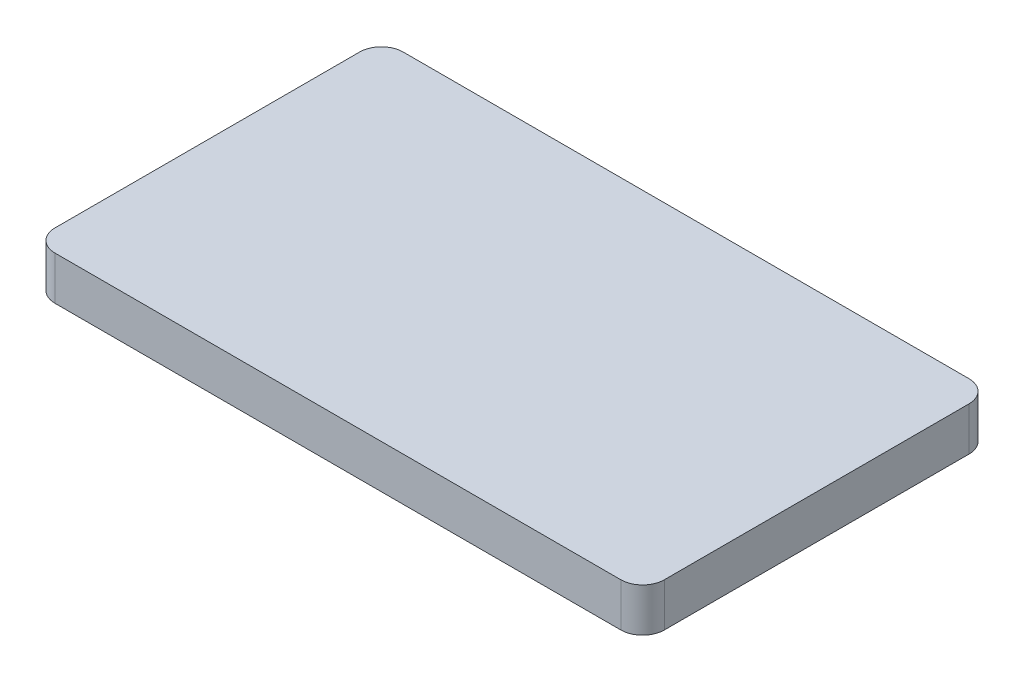
from build123d import *

# Parameters (mm, degrees)
SKETCH_1_W      = 7
SKETCH_1_H      = 4
EXTRUDE_1_DEPTH = 0.5
FILLET_1_R      = 0.25


with BuildPart() as part:
    # Эскиз1 → Бобышка-Вытянуть1 (new body)
    with BuildSketch(Plane(origin=(0, 0, 0), x_dir=(1, 0, 0), z_dir=(0, 1, 0))):
        Rectangle(SKETCH_1_W, SKETCH_1_H)
    extrude(amount=EXTRUDE_1_DEPTH)

    # Скругление1
    fillet_1_edges = [part.edges().sort_by_distance(p)[0] for p in [
        (-3.5, 0.25, -2),
        (3.5, 0.25, -2),
        (3.5, 0.25, 2),
        (-3.5, 0.25, 2),
    ]]
    fillet(fillet_1_edges, radius=FILLET_1_R)


solid = part.part
